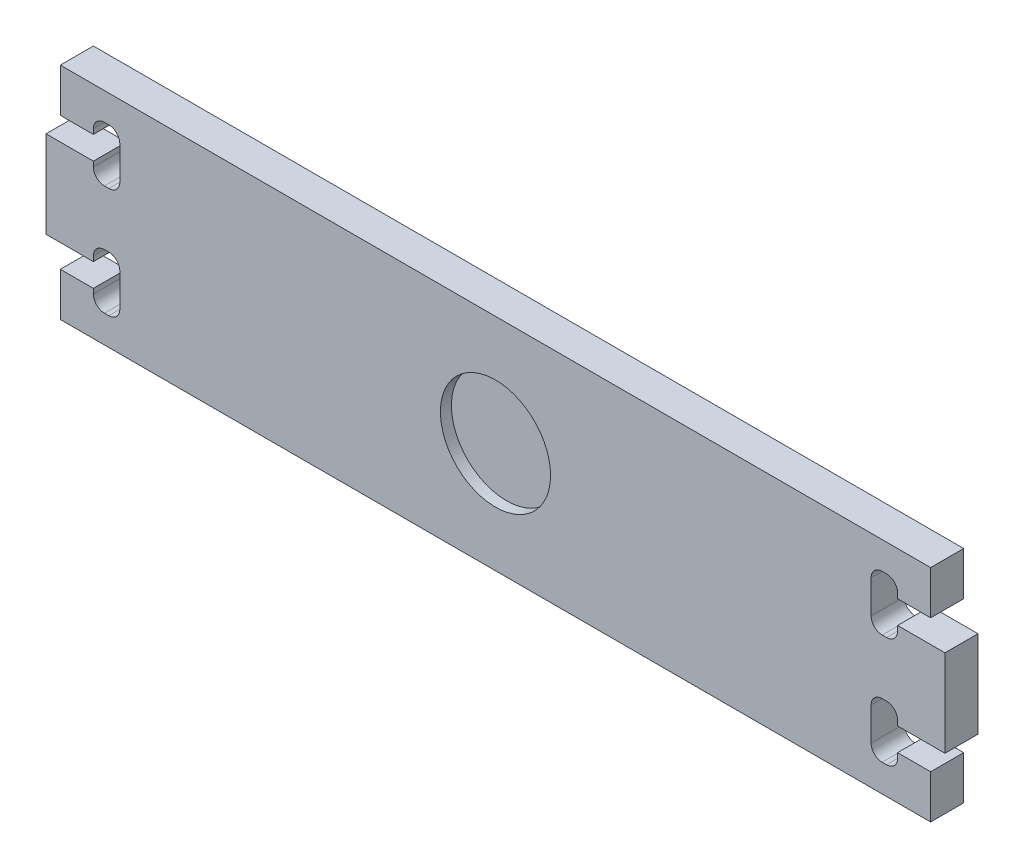
from build123d import *

# Parameters (mm, degrees)
BASE_SHAPE_DEPTH       = 3
SKETCH2_R              = 5
FORWARD_CUT_TEMP_DEPTH = 1
FILLET1_R              = 1


with BuildPart() as part:
    # Sketch1 → Base shape (new body)
    with BuildSketch(Plane.XY):
        Polygon((39.5, 10), (-39.5, 10), (-39.5, 6.05), (-36.5, 6.05), (-36.5, 7.5), (-34.1, 7.5), (-34.1, 2.5), (-36.5, 2.5), (-36.5, 3.95), (-40.8, 3.95), (-40.8, -3.95), (-36.5, -3.95), (-36.5, -2.5), (-34.1, -2.5), (-34.1, -7.5), (-36.5, -7.5), (-36.5, -6.05), (-39.5, -6.05), (-39.5, -10), (39.5, -10), (39.5, -6.05), (36.5, -6.05), (36.5, -7.5), (34.1, -7.5), (34.1, -2.5), (36.5, -2.5), (36.5, -3.95), (40.8, -3.95), (40.8, 3.95), (36.5, 3.95), (36.5, 2.5), (34.1, 2.5), (34.1, 7.5), (36.5, 7.5), (36.5, 6.05), (39.5, 6.05), align=None)
    extrude(amount=BASE_SHAPE_DEPTH)

    # Sketch2 → Forward cut (temp) (cut)
    with BuildSketch(Plane.XY.offset(3)):
        Circle(SKETCH2_R)
    extrude(amount=-FORWARD_CUT_TEMP_DEPTH, mode=Mode.SUBTRACT)

    # Fillet1
    fillet1_edges = [part.edges().sort_by_distance(p)[0] for p in [
        (36.5, -7.5, 1.5),
        (36.5, 2.5, 1.5),
        (34.1, 2.5, 1.5),
        (34.1, -7.5, 1.5),
        (36.5, -2.5, 1.5),
        (36.5, 7.5, 1.5),
        (34.1, -2.5, 1.5),
        (34.1, 7.5, 1.5),
        (-36.5, -2.5, 1.5),
        (-34.1, -2.5, 1.5),
        (-34.1, -7.5, 1.5),
        (-36.5, -7.5, 1.5),
        (-36.5, 2.5, 1.5),
        (-34.1, 2.5, 1.5),
        (-34.1, 7.5, 1.5),
        (-36.5, 7.5, 1.5),
    ]]
    fillet(fillet1_edges, radius=FILLET1_R)


solid = part.part
